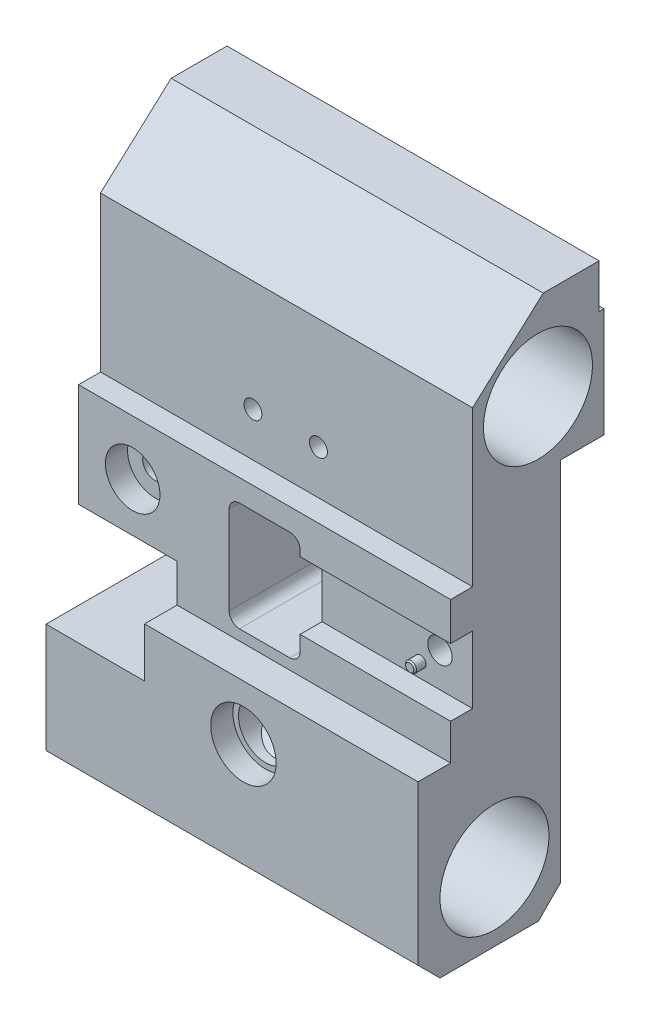
from build123d import *

# Parameters (mm, degrees)
BOSS_EXTRUDE1_DEPTH      = 54
BOSS_EXTRUDE1_DEPTH_BACK = 54
SKETCH1_R                = 15.83
SKETCH2_R                = 7.875
SKETCH2_R_2              = 2.6
SKETCH2_R_3              = 3.525
SKETCH2_R_4              = 3.55
SKETCH2_W                = 28.6
SKETCH2_H                = 25.4
CUT_EXTRUDE1_DEPTH       = 154.113939274
SKETCH3_W                = 43.7
SKETCH3_H                = 19.52
CUT_EXTRUDE2_DEPTH       = 6.36
SKETCH4_R                = 1.585
BOSS_EXTRUDE2_DEPTH      = 3.15
SKETCH10_R               = 1.585
CUT_EXTRUDE6_DEPTH       = 20
SKETCH11_R               = 5.5
SKETCH11_R_2             = 3.525
SKETCH11_R_3             = 5.42
CUT_EXTRUDE7_DEPTH       = 6.56
CHAMFER1_SIZE            = 0.4
SKETCH5_R                = 7.925
CUT_EXTRUDE3_DEPTH       = 6.44
SKETCH6_R                = 9.495
CUT_EXTRUDE4_DEPTH       = 6.44
SKETCH7_W                = 8.77
SKETCH7_H                = 34.96
BOSS_EXTRUDE3_DEPTH      = 3.1
SKETCH8_R                = 2
CUT_EXTRUDE5_DEPTH       = 15
SKETCH11_3_R             = 4.55
SKETCH11_3_R_2           = 2.6
CUT_EXTRUDE8_DEPTH       = 5.45
SKETCH12_R               = 9.475
CUT_EXTRUDE9_DEPTH       = 5.15
SKETCH13_R               = 2
CUT_EXTRUDE10_DEPTH      = 10
SKETCH14_R               = 2
CUT_EXTRUDE11_DEPTH      = 10


with BuildPart() as part:
    # Sketch1 → Boss-Extrude1 (new, two sides: drawn at the far end of the back side and taken through both)
    with BuildSketch(Plane(origin=(0, 0, 0), x_dir=(0, 0, -1), z_dir=(1, 0, 0)).offset(-BOSS_EXTRUDE1_DEPTH_BACK)):
        Polygon((14.15, 137.2), (30.37, 137.2), (30.37, 124.41), (31.79, 124.41), (31.79, 92.72), (19.1, 92.72), (19.1, -13.636038969), (12.736038969, -20), (-15.816038969, -20), (-22.18, -13.636038969), (-22.18, 32.5), (-12.73, 32.5), (-12.73, 73.61), (-6.36, 73.61), (-6.36, 118.61), align=None)
        Circle(SKETCH1_R, mode=Mode.SUBTRACT)
        with Locations((12.625, 111.985)):
            Circle(SKETCH1_R, mode=Mode.SUBTRACT)
    extrude(amount=BOSS_EXTRUDE1_DEPTH + BOSS_EXTRUDE1_DEPTH_BACK)

    # Sketch2 → Cut-Extrude1 (cut, through all)
    with BuildSketch(Plane(origin=(0, 0, -19.1), x_dir=(-1, 0, 0), z_dir=(0, 0, -1))):
        with Locations((-3.3, 16.595)):
            Circle(SKETCH2_R)
        with Locations((-9.25, 86.37)):
            Circle(SKETCH2_R_2)
        with Locations((9.75, 86.37)):
            Circle(SKETCH2_R_2)
        with Locations((38.3, 57.72)):
            Circle(SKETCH2_R_3)
        with Locations((-44.55, 52.92)):
            Circle(SKETCH2_R_4)
        with BuildLine():
            Line((-7.3, 67.2), (7.3, 67.2))
            ThreePointArc((7.3, 67.2), (9.421320344, 66.321320344), (10.3, 64.2))
            Line((10.3, 64.2), (10.3, 38.6))
            ThreePointArc((10.3, 38.6), (9.421320344, 36.478679656), (7.3, 35.6))
            Line((7.3, 35.6), (-7.3, 35.6))
            ThreePointArc((-7.3, 35.6), (-9.421320344, 36.478679656), (-10.3, 38.6))
            Line((-10.3, 38.6), (-10.3, 64.2))
            ThreePointArc((-10.3, 64.2), (-9.421320344, 66.321320344), (-7.3, 67.2))
        make_face()
        with Locations((39.7, 30.83)):
            Rectangle(SKETCH2_W, SKETCH2_H)
    extrude(amount=-CUT_EXTRUDE1_DEPTH, mode=Mode.SUBTRACT)

    # Sketch3 → Cut-Extrude2 (cut)
    with BuildSketch(Plane.XY.offset(12.73)):
        with Locations((32.15, 52.76)):
            Rectangle(SKETCH3_W, SKETCH3_H)
    extrude(amount=-CUT_EXTRUDE2_DEPTH, mode=Mode.SUBTRACT)

    # Sketch4 → Boss-Extrude2 (add)
    with BuildSketch(Plane.XY.offset(6.37)):
        with Locations((38.915, 47.335)):
            Circle(SKETCH4_R)
    extrude(amount=BOSS_EXTRUDE2_DEPTH)

    # Sketch10 → Cut-Extrude6 (cut)
    with BuildSketch(Plane(origin=(0, 0, -19.1), x_dir=(-1, 0, 0), z_dir=(0, 0, -1))):
        with Locations((-38.915, 47.335)):
            Circle(SKETCH10_R)
    extrude(amount=-CUT_EXTRUDE6_DEPTH, mode=Mode.SUBTRACT)

    # Sketch11 → Cut-Extrude7 (cut)
    # profile 1 of 2: a face of its own
    with BuildSketch(Plane(origin=(0, 0, -19.1), x_dir=(-1, 0, 0), z_dir=(0, 0, -1))):
        with Locations((38.3, 57.72)):
            Circle(SKETCH11_R)
        with Locations((38.3, 57.72)):
            Circle(SKETCH11_R_2, mode=Mode.SUBTRACT)
    # profile 2 of 2: a face of its own
    with BuildSketch(Plane(origin=(0, 0, -19.1), x_dir=(-1, 0, 0), z_dir=(0, 0, -1))):
        with Locations((-44.55, 52.92)):
            Circle(SKETCH11_R_3)
    extrude(amount=-CUT_EXTRUDE7_DEPTH, mode=Mode.SUBTRACT)

    # Chamfer1
    chamfer1_edges = [part.edges().sort_by_distance(p)[0] for p in [
        (37.33, 47.335, 9.52),
    ]]
    chamfer(chamfer1_edges, length=CHAMFER1_SIZE)

    # Sketch5 → Cut-Extrude3 (cut)
    with BuildSketch(Plane.XY.offset(12.73)):
        with Locations((-38.3, 57.72)):
            Circle(SKETCH5_R)
    extrude(amount=-CUT_EXTRUDE3_DEPTH, mode=Mode.SUBTRACT)

    # Sketch6 → Cut-Extrude4 (cut)
    with BuildSketch(Plane.XY.offset(22.18)):
        with Locations((3.3, 16.595)):
            Circle(SKETCH6_R)
    extrude(amount=-CUT_EXTRUDE4_DEPTH, mode=Mode.SUBTRACT)

    # Sketch7 → Boss-Extrude3 (add)
    with BuildSketch(Plane(origin=(0, 0, -19.1), x_dir=(-1, 0, 0), z_dir=(0, 0, -1))):
        with Locations((21.015, 16.59)):
            Rectangle(SKETCH7_W, SKETCH7_H)
    extrude(amount=BOSS_EXTRUDE3_DEPTH)

    # Sketch8 → Cut-Extrude5 (cut)
    with BuildSketch(Plane(origin=(0, 0, -22.2), x_dir=(-1, 0, 0), z_dir=(0, 0, -1))):
        with Locations((21.4, 29.135)):
            Circle(SKETCH8_R)
        with Locations((21.4, 3.82)):
            Circle(SKETCH8_R)
    extrude(amount=-CUT_EXTRUDE5_DEPTH, mode=Mode.SUBTRACT)

    # Sketch11<3> → Cut-Extrude8 (cut)
    # profile 1 of 2: a face of its own
    with BuildSketch(Plane(origin=(0, 0, -19.1), x_dir=(-1, 0, 0), z_dir=(0, 0, -1))):
        with Locations((-9.25, 86.37)):
            Circle(SKETCH11_3_R)
        with Locations((-9.25, 86.37)):
            Circle(SKETCH11_3_R_2, mode=Mode.SUBTRACT)
    # profile 2 of 2: a face of its own
    with BuildSketch(Plane(origin=(0, 0, -19.1), x_dir=(-1, 0, 0), z_dir=(0, 0, -1))):
        with Locations((9.75, 86.37)):
            Circle(SKETCH11_3_R)
        with Locations((9.75, 86.37)):
            Circle(SKETCH11_3_R_2, mode=Mode.SUBTRACT)
    extrude(amount=-CUT_EXTRUDE8_DEPTH, mode=Mode.SUBTRACT)

    # Sketch12 → Cut-Extrude9 (cut)
    with BuildSketch(Plane(origin=(0, 0, -19.1), x_dir=(-1, 0, 0), z_dir=(0, 0, -1))):
        with Locations((-3.3, 16.595)):
            Circle(SKETCH12_R)
    extrude(amount=-CUT_EXTRUDE9_DEPTH, mode=Mode.SUBTRACT)

    # Sketch13 → Cut-Extrude10 (cut)
    with BuildSketch(Plane(origin=(0, 0, -19.1), x_dir=(-1, 0, 0), z_dir=(0, 0, -1))):
        with Locations((-13.5, 73.72)):
            Circle(SKETCH13_R)
        with Locations((13.2, 73.72)):
            Circle(SKETCH13_R)
        with Locations((-13.5, 41.72)):
            Circle(SKETCH13_R)
        with Locations((13.2, 41.72)):
            Circle(SKETCH13_R)
        with Locations((20.3, 41.72)):
            Circle(SKETCH13_R)
        with Locations((-21, 41.92)):
            Circle(SKETCH13_R)
    extrude(amount=-CUT_EXTRUDE10_DEPTH, mode=Mode.SUBTRACT)

    # Sketch14 → Cut-Extrude11 (cut)
    with BuildSketch(Plane(origin=(0, 0, -30.37), x_dir=(-1, 0, 0), z_dir=(0, 0, -1))):
        with Locations((-0.2, 130.91)):
            Circle(SKETCH14_R)
    extrude(amount=-CUT_EXTRUDE11_DEPTH, mode=Mode.SUBTRACT)


solid = part.part
